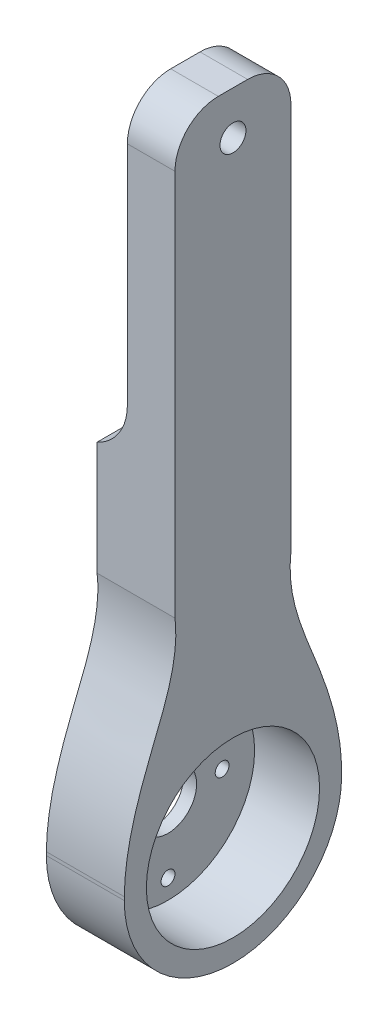
from build123d import *

# Parameters (mm, degrees)
SKETCH1_R               = 10
SKETCH1_R_2             = 0.8
SKETCH1_R_3             = 3.301767793
BOSS_EXTRUDE1_DEPTH     = 1.5
SKETCH2_R               = 10
BOSS_EXTRUDE2_DEPTH     = 9
CUT_EXTRUDE1_DEPTH      = 88.683957995
CUT_EXTRUDE1_DEPTH_BACK = 88.683957995
SKETCH3_R               = 1.5
FILLET1_R               = 5
CUT_EXTRUDE2_DEPTH      = 89.416451723
CUT_EXTRUDE2_DEPTH_BACK = 89.416451723
SKETCH4_W               = 11.042772081
SKETCH4_H               = 46.651109912
FILLET3_R               = 6


with BuildPart() as part:
    # Sketch1 → Boss-Extrude1 (new body)
    with BuildSketch(Plane(origin=(0, 0, 0), x_dir=(0, 0, -1), z_dir=(1, 0, 0))):
        with Locations((2.983378847, 10.826778074)):
            Circle(SKETCH1_R)
        with Locations((2.983378847, 18.576778074)):
            Circle(SKETCH1_R_2, mode=Mode.SUBTRACT)
        with Locations((2.983378847, 3.076778074)):
            Circle(SKETCH1_R_2, mode=Mode.SUBTRACT)
        with Locations((-3.266621153, 10.826778074)):
            Circle(SKETCH1_R_2, mode=Mode.SUBTRACT)
        with Locations((9.233378847, 10.826778074)):
            Circle(SKETCH1_R_2, mode=Mode.SUBTRACT)
        with Locations((2.983378847, 10.826778074)):
            Circle(SKETCH1_R_3, mode=Mode.SUBTRACT)
    extrude(amount=BOSS_EXTRUDE1_DEPTH)

    # Sketch2 → Boss-Extrude2 (add)
    with BuildSketch(Plane.ZY):
        with BuildLine():
            Line((-15.531923741, 85.826778074), (9.565166047, 85.826778074))
            Line((9.565166047, 85.826778074), (9.565166047, 10.826778074))
            ThreePointArc((9.565166047, 10.826778074), (-2.983378847, -1.721766821), (-15.531923741, 10.826778074))
            Line((-15.531923741, 10.826778074), (-15.531923741, 85.826778074))
        make_face()
        with Locations((-2.983378847, 10.826778074)):
            Circle(SKETCH2_R, mode=Mode.SUBTRACT)
    extrude(amount=-BOSS_EXTRUDE2_DEPTH)

    # Sketch3 → Cut-Extrude1 (cut, two sides: drawn at the far end of the back side and taken through both)
    with BuildSketch(Plane(origin=(9, 0, 0), x_dir=(0, 0, -1), z_dir=(1, 0, 0)).offset(-CUT_EXTRUDE1_DEPTH_BACK)):
        with Locations((2.983378847, 80.826778074)):
            Circle(SKETCH3_R)
        with BuildLine():
            Line((-3.709517939, 36.150412664), (-3.709517939, 97.572569437))
            Line((-3.709517939, 97.572569437), (-16.389018159, 97.572569437))
            Line((-16.389018159, 97.572569437), (-16.389018159, 8.14109285))
            Line((-16.389018159, 8.14109285), (-9.565166047, 10.826778074))
            add(Edge.make_bspline(
                [(-9.565166047, 10.826778074), (-9.602791773, 15.116710976), (-7.085897165, 23.501097028), (-3.155123098, 31.470187844), (-3.709517939, 36.150412664)],
                knots=[0, 0, 0, 0, 0.483956382, 1, 1, 1, 1], degree=3))
        make_face()
        with BuildLine():
            Line((22.355775853, 8.14109285), (15.531923741, 10.826778074))
            add(Edge.make_bspline(
                [(15.531923741, 10.826778074), (15.569549467, 15.116710976), (13.052654859, 23.501097028), (9.121880792, 31.470187844), (9.676275633, 36.150412664)],
                knots=[0, 0, 0, 0, 0.483956382, 1, 1, 1, 1], degree=3))
            Line((9.676275633, 36.150412664), (9.676275633, 97.572569437))
            Line((9.676275633, 97.572569437), (22.355775853, 97.572569437))
            Line((22.355775853, 97.572569437), (22.355775853, 8.14109285))
        make_face()
    extrude(amount=CUT_EXTRUDE1_DEPTH + CUT_EXTRUDE1_DEPTH_BACK, mode=Mode.SUBTRACT)

    # Fillet1
    fillet1_edges = [part.edges().sort_by_distance(p)[0] for p in [
        (4.5, 85.826778074, 3.709517939),
        (4.5, 85.826778074, -9.676275633),
    ]]
    fillet(fillet1_edges, radius=FILLET1_R)

    # Sketch4 → Cut-Extrude2 (cut, two sides: drawn at the far end of the back side and taken through both)
    with BuildSketch(Plane(origin=(0, 0, -9.676275633), x_dir=(-1, 0, 0), z_dir=(0, 0, -1)).offset(-CUT_EXTRUDE2_DEPTH_BACK)):
        with Locations((2.021386041, 72.566048538)):
            Rectangle(SKETCH4_W, SKETCH4_H)
    extrude(amount=CUT_EXTRUDE2_DEPTH + CUT_EXTRUDE2_DEPTH_BACK, mode=Mode.SUBTRACT)

    # Fillet3
    # the kernel refuses this fillet: 6 mm, written as the material it adds along each edge
    with BuildSketch(Plane(origin=(3.5, 49.240493582, 3.709517939), x_dir=(-1, 0, 0), z_dir=(0, 0, -1))) as fillet3_piece_1:
        with BuildLine():
            CenterArc((6, 5.454356057), FILLET3_R, 180, 65.375681648)
            Line((0, 5.454356057), (-0.12, 5.454356057))
            Line((-0.12, 5.454356057), (-0.12, 0))
            Line((-0.12, 0), (0, -0.12))
            ThreePointArc((0, -0.12), (1.75, -0.12), (3.45, -0.109087121))
            Line((3.45, -0.109087121), (3.5, 0))
        make_face()
    extrude(amount=13.385793571)


solid = part.part
